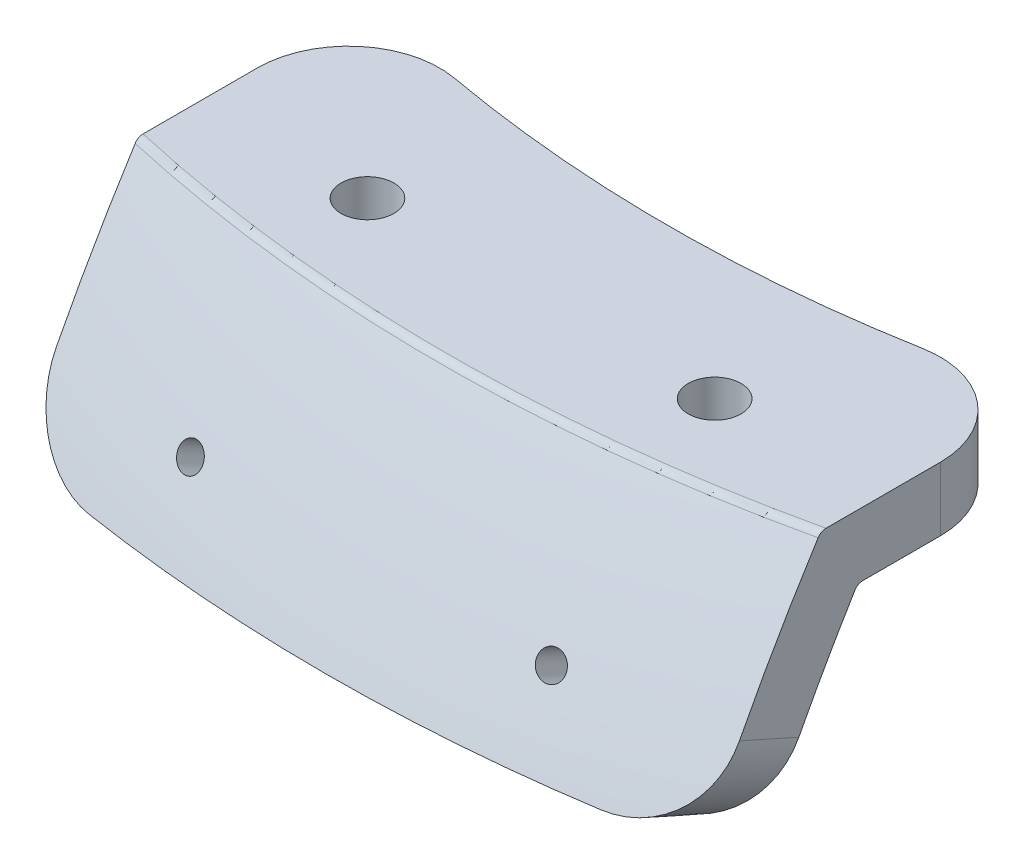
from build123d import *

# Parameters (mm, degrees)
REVOLVE1_ANGLE     = 30.000000000000068
SKETCH5_OUTSIDE_W  = 117.778
SKETCH5_OUTSIDE_H  = 65.886
CUT_EXTRUDE2_DEPTH = 252.18529735234546
FILLET1_R          = 10
FILLET2_R          = 1
SKETCH6_R          = 2.9000000000000363
CUT_EXTRUDE3_DEPTH = 189.07070419269826


with BuildPart() as part:
    # Sketch1 → Revolve1 (revolve, symmetric)
    with BuildSketch(Plane(origin=(0, 0, 0), x_dir=(0, 0, -1), z_dir=(1, 0, 0))) as revolve1_sk:
        with BuildLine():
            Line((-182.35774731017037, 142.36255496026888), (-175.97602386974447, 139.48616730734054))
            ThreePointArc((-175.97602386974447, 139.48616730734054), (-171.12326361518225, 149.47531665807526), (-165.70405663774088, 159.16884968660477))
            Line((-165.70405663774088, 159.16884968660477), (-144.78715490839105, 159.16884968660477))
            Line((-144.78715490839105, 159.16884968660477), (-144.78715490839105, 166.16884968660477))
            Line((-144.78715490839105, 166.16884968660477), (-169.62958874996124, 166.16884968660477))
            ThreePointArc((-169.62958874996124, 166.16884968660477), (-176.39573720423718, 154.4806706862104), (-182.35774731017037, 142.36255496026888))
        make_face()
    revolve(axis=Axis((0, 0, 0), (0, 1, 0)), revolution_arc=REVOLVE1_ANGLE / 2)
    revolve(revolve1_sk.sketch, axis=Axis((0, 0, 0), (0, -1, 0)), revolution_arc=REVOLVE1_ANGLE / 2)

    # Sketch4 → Cut-Revolve1 (revolve, cut)
    with BuildSketch(Plane(origin=(0, 47.768342894686725, -24.339186385019115), x_dir=(0, 0.45399049973954464, 0.8910065241883689), z_dir=(0, -0.8910065241883689, 0.45399049973954464))):
        Polygon((200.3216852155454, 19.031606271083962), (239.0176946479082, 22.417068420107935), (239.1484282620297, 20.922776372970326), (200.4524188296669, 17.53731422394635), align=None)
    cut_revolve1 = revolve(axis=Axis((-17.53731422394635, 138.7718366931677, 154.26522658155352), (-0.0871557427476583, 0.4522629288245569, 0.8876159753616075)), mode=Mode.SUBTRACT)

    # Mirror1: Cut-Revolve1 across plane
    add(cut_revolve1.mirror(Plane(origin=(0, 0, 0), x_dir=(0, 0, 1), z_dir=(1, 0, 0))), mode=Mode.SUBTRACT)

    # Sketch5 outside → Cut-Extrude2 (cut, through all)
    with BuildSketch(Plane(origin=(0, 0, 0), x_dir=(1, 0, 0), z_dir=(0, 1, 0))):
        with Locations((0, -161.106)):
            Rectangle(SKETCH5_OUTSIDE_W, SKETCH5_OUTSIDE_H)
        Polygon((37.4736731765006, -139.85365224093093), (-37.47367317650061, -139.85365224093093), (-37.473673176500604, -182.35774731017028), (37.473673176500604, -182.35774731017028), align=None, mode=Mode.SUBTRACT)
    extrude(amount=CUT_EXTRUDE2_DEPTH, mode=Mode.SUBTRACT)

    # Fillet1
    fillet1_edges = [part.edges().sort_by_distance(p)[0] for p in [
        (-37.473673176500604, 162.66884968660477, 139.85365224093093),
        (37.473673176500604, 162.66884968660477, 139.85365224093093),
        (-37.473673176500604, 140.9238703907979, 175.20304381237648),
        (37.473673176500604, 140.92387039079793, 175.2030438123766),
    ]]
    fillet(fillet1_edges, radius=FILLET1_R)

    # Fillet2
    fillet2_edges = [part.edges().sort_by_distance(p)[0] for p in [
        (-2.132e-14, 166.16884968660477, 169.62958874996124),
        (0, 159.16884968660477, 165.7040566377409),
    ]]
    fillet(fillet2_edges, radius=FILLET2_R)

    # Sketch6 → Cut-Extrude3 (cut, through all)
    with BuildSketch(Plane(origin=(0, 166.16884968660477, 0), x_dir=(1, 0, 0), z_dir=(0, 1, 0))):
        with Locations((19.049999999999898, -158.67424557151682)):
            Circle(SKETCH6_R)
        with Locations((-19.050000000000104, -158.67424557151682)):
            Circle(SKETCH6_R)
    extrude(amount=-CUT_EXTRUDE3_DEPTH, mode=Mode.SUBTRACT)


solid = part.part
